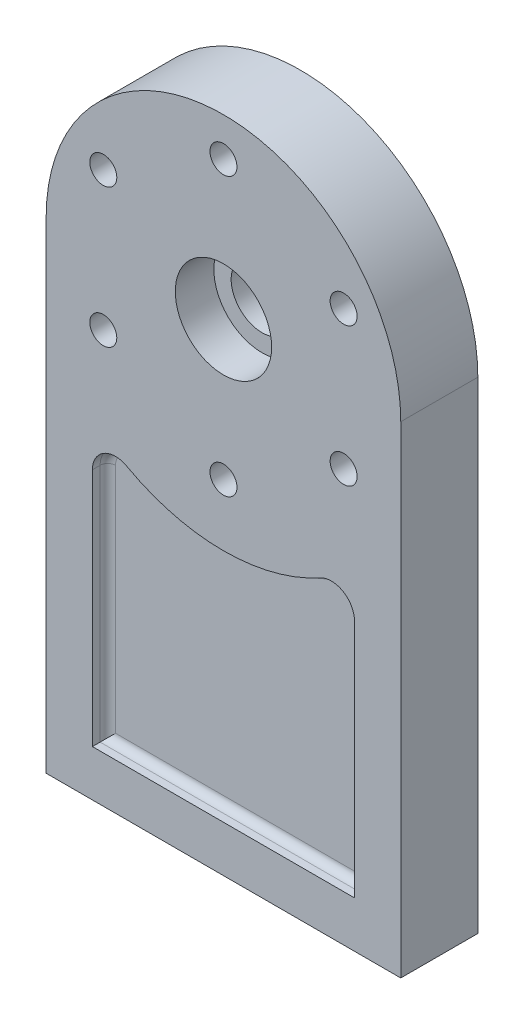
from build123d import *

# Parameters (mm, degrees)
SKETCH1_R                               = 8
BOSS_EXTRUDE1_DEPTH                     = 10
SKETCH3_R                               = 12.5
CUT_EXTRUDE1_DEPTH                      = 10
SKETCH4_R                               = 3.5
CUT_EXTRUDE2_DEPTH                      = 179.204938203
TAP_DRILL_FOR_M10X1_25_TAP1_D           = 8.8
TAP_DRILL_FOR_M10X1_25_TAP1_DEPTH       = 24
TAP_DRILL_FOR_M10X1_25_TAP1_CSINK_D     = 8.85
TAP_DRILL_FOR_M10X1_25_TAP1_CSINK_ANGLE = 90
TAP_DRILL_FOR_M10X1_25_TAP1_TIP         = 2.643786724
CUT_EXTRUDE4_DEPTH                      = 4
FILLET1_R                               = 2
FILLET1_OF_MIRROR1_R                    = 2
SKETCH9_R                               = 6
CUT_EXTRUDE5_DEPTH                      = 6
CIRPATTERN1_COUNT                       = 6


with BuildPart() as part:
    # Sketch1 → Boss-Extrude1 (new, symmetric)
    with BuildSketch(Plane.XY):
        with BuildLine():
            Line((46, 125), (46, 0))
            Line((46, 0), (-46, 0))
            Line((-46, 0), (-46, 125))
            ThreePointArc((-46, 125), (0, 171), (46, 125))
        make_face()
        with Locations((0, 125)):
            Circle(SKETCH1_R, mode=Mode.SUBTRACT)
    extrude(amount=BOSS_EXTRUDE1_DEPTH, both=True)

    # Sketch3 → Cut-Extrude1 (cut)
    with BuildSketch(Plane.XY.offset(10)):
        with Locations((0, 125)):
            Circle(SKETCH3_R)
    extrude(amount=-CUT_EXTRUDE1_DEPTH, mode=Mode.SUBTRACT)

    # Sketch4 → Cut-Extrude2 (cut, through all)
    with BuildSketch(Plane.XY.offset(10)):
        with Locations((0, 161)):
            Circle(SKETCH4_R)
    cut_extrude2 = extrude(amount=-CUT_EXTRUDE2_DEPTH, mode=Mode.SUBTRACT)

    # Tap Drill for M10x1.25 Tap1
    with Locations(Plane(origin=(0, 0, 0), x_dir=(-1, 0, 0), z_dir=(0, -1, 0))):
        with Locations((-30, 0), (30, 0)):
            CounterSinkHole(TAP_DRILL_FOR_M10X1_25_TAP1_D / 2, TAP_DRILL_FOR_M10X1_25_TAP1_CSINK_D / 2, depth=TAP_DRILL_FOR_M10X1_25_TAP1_DEPTH, counter_sink_angle=TAP_DRILL_FOR_M10X1_25_TAP1_CSINK_ANGLE)
            with Locations((0, 0, -(TAP_DRILL_FOR_M10X1_25_TAP1_DEPTH + TAP_DRILL_FOR_M10X1_25_TAP1_TIP / 2))):  # 118° drill point
                Cone(0, TAP_DRILL_FOR_M10X1_25_TAP1_D / 2, TAP_DRILL_FOR_M10X1_25_TAP1_TIP, mode=Mode.SUBTRACT)

    # Sketch8 → Cut-Extrude4 (cut)
    with BuildSketch(Plane.XY.offset(10)):
        with BuildLine():
            Line((-34, 74.206299603), (-34, 12))
            Line((-34, 12), (34, 12))
            Line((34, 12), (34, 74.206299603))
            ThreePointArc((34, 74.206299603), (31.051285766, 79.372502771), (25.103448276, 79.460820334))
            ThreePointArc((25.103448276, 79.460820334), (0, 73), (-25.103448276, 79.460820334))
            ThreePointArc((-25.103448276, 79.460820334), (-31.051285766, 79.372502771), (-34, 74.206299603))
        make_face()
    cut_extrude4 = extrude(amount=-CUT_EXTRUDE4_DEPTH, mode=Mode.SUBTRACT)

    # Fillet1
    fillet1_edges = [part.edges().sort_by_distance(p)[0] for p in [
        (34, 43.103149802, 6),
        (0, 12, 6),
        (-34, 43.103149802, 6),
        (-31.051285766, 79.372502771, 6),
        (0, 73, 6),
        (31.051285766, 79.372502771, 6),
    ]]
    fillet(fillet1_edges, radius=FILLET1_R)

    # Mirror1: Cut-Extrude4 across plane
    add(cut_extrude4.mirror(Plane.XY), mode=Mode.SUBTRACT)

    # Fillet1 of Mirror1
    fillet1_of_mirror1_edges = [part.edges().sort_by_distance(p)[0] for p in [
        (34, 43.103149802, -6),
        (0, 12, -6),
        (-34, 43.103149802, -6),
        (-31.051285766, 79.372502771, -6),
        (0, 73, -6),
        (31.051285766, 79.372502771, -6),
    ]]
    fillet(fillet1_of_mirror1_edges, radius=FILLET1_OF_MIRROR1_R)

    # Sketch9 → Cut-Extrude5 (cut)
    with BuildSketch(Plane(origin=(0, 0, -10), x_dir=(-1, 0, 0), z_dir=(0, 0, -1))):
        with Locations((0, 161)):
            Circle(SKETCH9_R)
    cut_extrude5 = extrude(amount=-CUT_EXTRUDE5_DEPTH, mode=Mode.SUBTRACT)

    # CirPattern1: Cut-Extrude2, Cut-Extrude5 ×6 about axis
    cirpattern1_axis = Axis((0, 125, -10), (0, 0, 1))
    add([cut_extrude2.rotate(cirpattern1_axis, i * 360 / CIRPATTERN1_COUNT) for i in range(1, CIRPATTERN1_COUNT)], mode=Mode.SUBTRACT)
    add([cut_extrude5.rotate(cirpattern1_axis, i * 360 / CIRPATTERN1_COUNT) for i in range(1, CIRPATTERN1_COUNT)], mode=Mode.SUBTRACT)


solid = part.part
